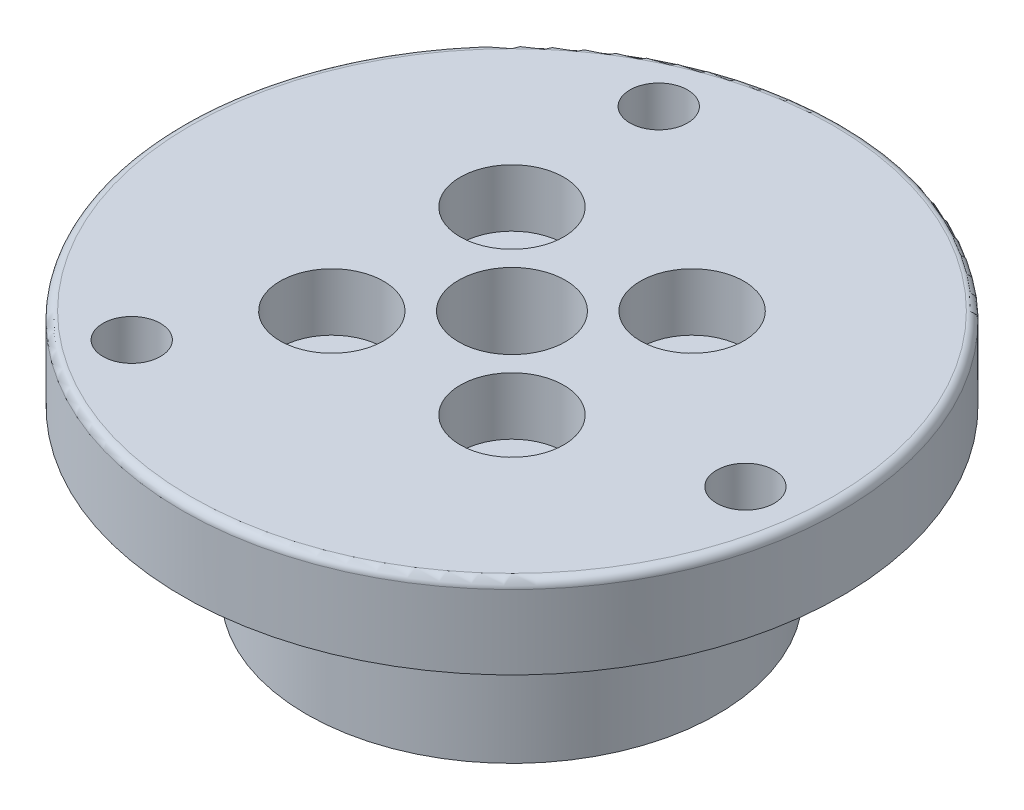
from build123d import *

# Parameters (mm, degrees)
SKETCH1_R      = 20.05
SKETCH1_R_2    = 1.75
SKETCH1_R_3    = 3.25
EXTRUDE1_DEPTH = 15
SKETCH7_R      = 3.15
EXTRUDE4_DEPTH = 3.5
SKETCH8_R      = 20.05
SKETCH8_R_2    = 12.5
EXTRUDE5_DEPTH = 10
FILLET_1_R     = 0.5


with BuildPart() as part:
    # Sketch1 → Extrude1 (new body)
    with BuildSketch(Plane(origin=(0, 0, 0), x_dir=(1, 0, 0), z_dir=(0, 1, 0))):
        Circle(SKETCH1_R)
        with Locations((-10.044563579, -13.090330115)):
            Circle(SKETCH1_R_2, mode=Mode.SUBTRACT)
        with Locations((-5.480077554, -5.480077554)):
            Circle(SKETCH1_R_2, mode=Mode.SUBTRACT)
        Circle(SKETCH1_R_3, mode=Mode.SUBTRACT)
        with Locations((5.480077554, -5.480077554)):
            Circle(SKETCH1_R_2, mode=Mode.SUBTRACT)
        with Locations((16.358840213, -2.153682172)):
            Circle(SKETCH1_R_2, mode=Mode.SUBTRACT)
        with Locations((-5.480077554, 5.480077554)):
            Circle(SKETCH1_R_2, mode=Mode.SUBTRACT)
        with Locations((-6.314276634, 15.244012286)):
            Circle(SKETCH1_R_2, mode=Mode.SUBTRACT)
        with Locations((5.480077554, 5.480077554)):
            Circle(SKETCH1_R_2, mode=Mode.SUBTRACT)
    extrude(amount=EXTRUDE1_DEPTH)

    # Sketch7 → Extrude4 (cut)
    with BuildSketch(Plane(origin=(0, 15, 0), x_dir=(1, 0, 0), z_dir=(0, 1, 0))):
        with Locations((-5.480077554, 5.480077554)):
            Circle(SKETCH7_R)
        with Locations((5.480077554, 5.480077554)):
            Circle(SKETCH7_R)
        with Locations((5.480077554, -5.480077554)):
            Circle(SKETCH7_R)
        with Locations((-5.480077554, -5.480077554)):
            Circle(SKETCH7_R)
    extrude(amount=-EXTRUDE4_DEPTH, mode=Mode.SUBTRACT)

    # Sketch8 → Extrude5 (cut)
    with BuildSketch(Plane.XZ):
        Circle(SKETCH8_R)
        Circle(SKETCH8_R_2, mode=Mode.SUBTRACT)
    extrude(amount=-EXTRUDE5_DEPTH, mode=Mode.SUBTRACT)

    # 圓角1
    fillet_1_edges = [part.edges().sort_by_distance(p)[0] for p in [
        (-20.05, 15, 0),
    ]]
    fillet(fillet_1_edges, radius=FILLET_1_R)


solid = part.part
